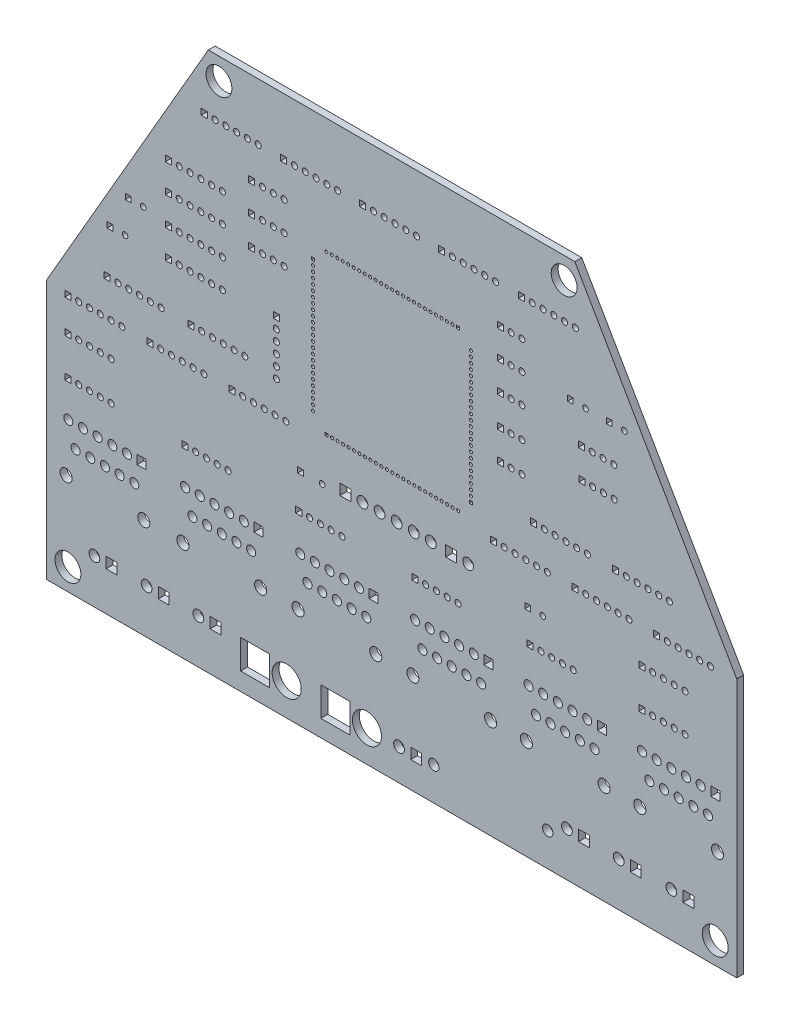
from build123d import *

# Parameters (mm, degrees)
MODEL_R            = 0.65
MODEL_R_2          = 0.7
MODEL_R_3          = 1.2
MODEL_R_4          = 0.35
MODEL_R_5          = 3.375
MODEL_R_6          = 1.05
MODEL_R_7          = 1.4
MODEL_R_8          = 1.25
MODEL_R_9          = 3
MODEL_W            = 1.3
MODEL_H            = 1.3
MODEL_W_2          = 1.4
MODEL_H_2          = 1.4
MODEL_W_3          = 0.7
MODEL_H_3          = 0.7
MODEL_W_4          = 6.75
MODEL_H_4          = 6.75
MODEL_W_5          = 2.1
MODEL_H_5          = 2.1
MODEL_W_6          = 2.5
MODEL_H_6          = 2.5
BOSS_EXTRU_1_DEPTH = 1.6


with BuildPart() as part:
    # Model → Boss.-Extru.1 (new body)
    with BuildSketch(Plane.XY):
        Polygon((0, 0), (160, 0), (160, 60), (122.47, 125), (37.53, 125), (0, 60), align=None)
        with Locations((63.9, 51.1)):
            Circle(MODEL_R, mode=Mode.SUBTRACT)
        with Locations((107.7, 76.2)):
            Circle(MODEL_R_2, mode=Mode.SUBTRACT)
        with Locations((110.2, 76.2)):
            Circle(MODEL_R_2, mode=Mode.SUBTRACT)
        with Locations((107.7, 83.1)):
            Circle(MODEL_R_2, mode=Mode.SUBTRACT)
        with Locations((110.2, 83.1)):
            Circle(MODEL_R_2, mode=Mode.SUBTRACT)
        with Locations((107.7, 90.1)):
            Circle(MODEL_R_2, mode=Mode.SUBTRACT)
        with Locations((110.2, 90.1)):
            Circle(MODEL_R_2, mode=Mode.SUBTRACT)
        with Locations((107.7, 96.8)):
            Circle(MODEL_R_2, mode=Mode.SUBTRACT)
        with Locations((110.2, 96.8)):
            Circle(MODEL_R_2, mode=Mode.SUBTRACT)
        with Locations((107.7, 103.4)):
            Circle(MODEL_R_2, mode=Mode.SUBTRACT)
        with Locations((110.2, 103.4)):
            Circle(MODEL_R_2, mode=Mode.SUBTRACT)
        with Locations((89.8, 7.7)):
            Circle(MODEL_R_3, mode=Mode.SUBTRACT)
        with Locations((116.2, 7.7)):
            Circle(MODEL_R_3, mode=Mode.SUBTRACT)
        with Locations((61.8, 93.89)):
            Circle(MODEL_R_4, mode=Mode.SUBTRACT)
        with Locations((61.8, 92.62)):
            Circle(MODEL_R_4, mode=Mode.SUBTRACT)
        with Locations((61.8, 91.35)):
            Circle(MODEL_R_4, mode=Mode.SUBTRACT)
        with Locations((61.8, 90.08)):
            Circle(MODEL_R_4, mode=Mode.SUBTRACT)
        with Locations((61.8, 88.81)):
            Circle(MODEL_R_4, mode=Mode.SUBTRACT)
        with Locations((61.8, 87.54)):
            Circle(MODEL_R_4, mode=Mode.SUBTRACT)
        with Locations((61.8, 86.27)):
            Circle(MODEL_R_4, mode=Mode.SUBTRACT)
        with Locations((61.8, 85)):
            Circle(MODEL_R_4, mode=Mode.SUBTRACT)
        with Locations((61.8, 83.73)):
            Circle(MODEL_R_4, mode=Mode.SUBTRACT)
        with Locations((61.8, 82.46)):
            Circle(MODEL_R_4, mode=Mode.SUBTRACT)
        with Locations((61.8, 81.19)):
            Circle(MODEL_R_4, mode=Mode.SUBTRACT)
        with Locations((61.8, 79.92)):
            Circle(MODEL_R_4, mode=Mode.SUBTRACT)
        with Locations((61.8, 78.65)):
            Circle(MODEL_R_4, mode=Mode.SUBTRACT)
        with Locations((61.8, 77.38)):
            Circle(MODEL_R_4, mode=Mode.SUBTRACT)
        with Locations((61.8, 76.11)):
            Circle(MODEL_R_4, mode=Mode.SUBTRACT)
        with Locations((61.8, 74.84)):
            Circle(MODEL_R_4, mode=Mode.SUBTRACT)
        with Locations((61.8, 73.57)):
            Circle(MODEL_R_4, mode=Mode.SUBTRACT)
        with Locations((61.8, 72.3)):
            Circle(MODEL_R_4, mode=Mode.SUBTRACT)
        with Locations((61.8, 71.03)):
            Circle(MODEL_R_4, mode=Mode.SUBTRACT)
        with Locations((61.8, 69.76)):
            Circle(MODEL_R_4, mode=Mode.SUBTRACT)
        with Locations((61.8, 68.49)):
            Circle(MODEL_R_4, mode=Mode.SUBTRACT)
        with Locations((61.8, 67.22)):
            Circle(MODEL_R_4, mode=Mode.SUBTRACT)
        with Locations((61.8, 65.95)):
            Circle(MODEL_R_4, mode=Mode.SUBTRACT)
        with Locations((61.8, 64.68)):
            Circle(MODEL_R_4, mode=Mode.SUBTRACT)
        with Locations((66.21, 61.5)):
            Circle(MODEL_R_4, mode=Mode.SUBTRACT)
        with Locations((67.48, 61.5)):
            Circle(MODEL_R_4, mode=Mode.SUBTRACT)
        with Locations((68.75, 61.5)):
            Circle(MODEL_R_4, mode=Mode.SUBTRACT)
        with Locations((70.02, 61.5)):
            Circle(MODEL_R_4, mode=Mode.SUBTRACT)
        with Locations((71.29, 61.5)):
            Circle(MODEL_R_4, mode=Mode.SUBTRACT)
        with Locations((72.56, 61.5)):
            Circle(MODEL_R_4, mode=Mode.SUBTRACT)
        with Locations((73.83, 61.5)):
            Circle(MODEL_R_4, mode=Mode.SUBTRACT)
        with Locations((75.1, 61.5)):
            Circle(MODEL_R_4, mode=Mode.SUBTRACT)
        with Locations((76.37, 61.5)):
            Circle(MODEL_R_4, mode=Mode.SUBTRACT)
        with Locations((77.64, 61.5)):
            Circle(MODEL_R_4, mode=Mode.SUBTRACT)
        with Locations((78.91, 61.5)):
            Circle(MODEL_R_4, mode=Mode.SUBTRACT)
        with Locations((80.18, 61.5)):
            Circle(MODEL_R_4, mode=Mode.SUBTRACT)
        with Locations((81.45, 61.5)):
            Circle(MODEL_R_4, mode=Mode.SUBTRACT)
        with Locations((82.72, 61.5)):
            Circle(MODEL_R_4, mode=Mode.SUBTRACT)
        with Locations((83.99, 61.5)):
            Circle(MODEL_R_4, mode=Mode.SUBTRACT)
        with Locations((85.26, 61.5)):
            Circle(MODEL_R_4, mode=Mode.SUBTRACT)
        with Locations((86.53, 61.5)):
            Circle(MODEL_R_4, mode=Mode.SUBTRACT)
        with Locations((87.8, 61.5)):
            Circle(MODEL_R_4, mode=Mode.SUBTRACT)
        with Locations((89.07, 61.5)):
            Circle(MODEL_R_4, mode=Mode.SUBTRACT)
        with Locations((90.34, 61.5)):
            Circle(MODEL_R_4, mode=Mode.SUBTRACT)
        with Locations((91.61, 61.5)):
            Circle(MODEL_R_4, mode=Mode.SUBTRACT)
        with Locations((92.88, 61.5)):
            Circle(MODEL_R_4, mode=Mode.SUBTRACT)
        with Locations((94.15, 61.5)):
            Circle(MODEL_R_4, mode=Mode.SUBTRACT)
        with Locations((95.42, 61.5)):
            Circle(MODEL_R_4, mode=Mode.SUBTRACT)
        with Locations((94.09, 98.2)):
            Circle(MODEL_R_4, mode=Mode.SUBTRACT)
        with Locations((92.82, 98.2)):
            Circle(MODEL_R_4, mode=Mode.SUBTRACT)
        with Locations((91.55, 98.2)):
            Circle(MODEL_R_4, mode=Mode.SUBTRACT)
        with Locations((90.28, 98.2)):
            Circle(MODEL_R_4, mode=Mode.SUBTRACT)
        with Locations((89.01, 98.2)):
            Circle(MODEL_R_4, mode=Mode.SUBTRACT)
        with Locations((87.74, 98.2)):
            Circle(MODEL_R_4, mode=Mode.SUBTRACT)
        with Locations((86.47, 98.2)):
            Circle(MODEL_R_4, mode=Mode.SUBTRACT)
        with Locations((85.2, 98.2)):
            Circle(MODEL_R_4, mode=Mode.SUBTRACT)
        with Locations((83.93, 98.2)):
            Circle(MODEL_R_4, mode=Mode.SUBTRACT)
        with Locations((82.66, 98.2)):
            Circle(MODEL_R_4, mode=Mode.SUBTRACT)
        with Locations((81.39, 98.2)):
            Circle(MODEL_R_4, mode=Mode.SUBTRACT)
        with Locations((80.12, 98.2)):
            Circle(MODEL_R_4, mode=Mode.SUBTRACT)
        with Locations((78.85, 98.2)):
            Circle(MODEL_R_4, mode=Mode.SUBTRACT)
        with Locations((77.58, 98.2)):
            Circle(MODEL_R_4, mode=Mode.SUBTRACT)
        with Locations((76.31, 98.2)):
            Circle(MODEL_R_4, mode=Mode.SUBTRACT)
        with Locations((75.04, 98.2)):
            Circle(MODEL_R_4, mode=Mode.SUBTRACT)
        with Locations((73.77, 98.2)):
            Circle(MODEL_R_4, mode=Mode.SUBTRACT)
        with Locations((72.5, 98.2)):
            Circle(MODEL_R_4, mode=Mode.SUBTRACT)
        with Locations((71.23, 98.2)):
            Circle(MODEL_R_4, mode=Mode.SUBTRACT)
        with Locations((69.96, 98.2)):
            Circle(MODEL_R_4, mode=Mode.SUBTRACT)
        with Locations((68.69, 98.2)):
            Circle(MODEL_R_4, mode=Mode.SUBTRACT)
        with Locations((67.42, 98.2)):
            Circle(MODEL_R_4, mode=Mode.SUBTRACT)
        with Locations((66.15, 98.2)):
            Circle(MODEL_R_4, mode=Mode.SUBTRACT)
        with Locations((64.88, 98.2)):
            Circle(MODEL_R_4, mode=Mode.SUBTRACT)
        with Locations((98.4, 65.91)):
            Circle(MODEL_R_4, mode=Mode.SUBTRACT)
        with Locations((98.4, 67.18)):
            Circle(MODEL_R_4, mode=Mode.SUBTRACT)
        with Locations((98.4, 68.45)):
            Circle(MODEL_R_4, mode=Mode.SUBTRACT)
        with Locations((98.4, 69.72)):
            Circle(MODEL_R_4, mode=Mode.SUBTRACT)
        with Locations((98.4, 70.99)):
            Circle(MODEL_R_4, mode=Mode.SUBTRACT)
        with Locations((98.4, 72.26)):
            Circle(MODEL_R_4, mode=Mode.SUBTRACT)
        with Locations((98.4, 73.53)):
            Circle(MODEL_R_4, mode=Mode.SUBTRACT)
        with Locations((98.4, 74.8)):
            Circle(MODEL_R_4, mode=Mode.SUBTRACT)
        with Locations((98.4, 76.07)):
            Circle(MODEL_R_4, mode=Mode.SUBTRACT)
        with Locations((98.4, 77.34)):
            Circle(MODEL_R_4, mode=Mode.SUBTRACT)
        with Locations((98.4, 78.61)):
            Circle(MODEL_R_4, mode=Mode.SUBTRACT)
        with Locations((98.4, 79.88)):
            Circle(MODEL_R_4, mode=Mode.SUBTRACT)
        with Locations((98.4, 81.15)):
            Circle(MODEL_R_4, mode=Mode.SUBTRACT)
        with Locations((98.4, 82.42)):
            Circle(MODEL_R_4, mode=Mode.SUBTRACT)
        with Locations((98.4, 83.69)):
            Circle(MODEL_R_4, mode=Mode.SUBTRACT)
        with Locations((98.4, 84.96)):
            Circle(MODEL_R_4, mode=Mode.SUBTRACT)
        with Locations((98.4, 86.23)):
            Circle(MODEL_R_4, mode=Mode.SUBTRACT)
        with Locations((98.4, 87.5)):
            Circle(MODEL_R_4, mode=Mode.SUBTRACT)
        with Locations((98.4, 88.77)):
            Circle(MODEL_R_4, mode=Mode.SUBTRACT)
        with Locations((98.4, 90.04)):
            Circle(MODEL_R_4, mode=Mode.SUBTRACT)
        with Locations((98.4, 91.31)):
            Circle(MODEL_R_4, mode=Mode.SUBTRACT)
        with Locations((98.4, 92.58)):
            Circle(MODEL_R_4, mode=Mode.SUBTRACT)
        with Locations((98.4, 93.85)):
            Circle(MODEL_R_4, mode=Mode.SUBTRACT)
        with Locations((98.4, 95.12)):
            Circle(MODEL_R_4, mode=Mode.SUBTRACT)
        with Locations((55.7, 7.5)):
            Circle(MODEL_R_5, mode=Mode.SUBTRACT)
        with Locations((74.3, 7.3)):
            Circle(MODEL_R_5, mode=Mode.SUBTRACT)
        with Locations((153.33, 29.42)):
            Circle(MODEL_R_6, mode=Mode.SUBTRACT)
        with Locations((151.63, 34.5)):
            Circle(MODEL_R_6, mode=Mode.SUBTRACT)
        with Locations((149.93, 29.42)):
            Circle(MODEL_R_6, mode=Mode.SUBTRACT)
        with Locations((148.23, 34.5)):
            Circle(MODEL_R_6, mode=Mode.SUBTRACT)
        with Locations((146.53, 29.42)):
            Circle(MODEL_R_6, mode=Mode.SUBTRACT)
        with Locations((144.83, 34.5)):
            Circle(MODEL_R_6, mode=Mode.SUBTRACT)
        with Locations((143.13, 29.42)):
            Circle(MODEL_R_6, mode=Mode.SUBTRACT)
        with Locations((141.43, 34.5)):
            Circle(MODEL_R_6, mode=Mode.SUBTRACT)
        with Locations((139.73, 29.42)):
            Circle(MODEL_R_6, mode=Mode.SUBTRACT)
        with Locations((138.03, 34.5)):
            Circle(MODEL_R_6, mode=Mode.SUBTRACT)
        with Locations((155.53, 23.1)):
            Circle(MODEL_R_7, mode=Mode.SUBTRACT)
        with Locations((137.53, 23.1)):
            Circle(MODEL_R_7, mode=Mode.SUBTRACT)
        with Locations((100.75, 29.5)):
            Circle(MODEL_R_6, mode=Mode.SUBTRACT)
        with Locations((99.05, 34.58)):
            Circle(MODEL_R_6, mode=Mode.SUBTRACT)
        with Locations((97.35, 29.5)):
            Circle(MODEL_R_6, mode=Mode.SUBTRACT)
        with Locations((95.65, 34.58)):
            Circle(MODEL_R_6, mode=Mode.SUBTRACT)
        with Locations((93.95, 29.5)):
            Circle(MODEL_R_6, mode=Mode.SUBTRACT)
        with Locations((92.25, 34.58)):
            Circle(MODEL_R_6, mode=Mode.SUBTRACT)
        with Locations((90.55, 29.5)):
            Circle(MODEL_R_6, mode=Mode.SUBTRACT)
        with Locations((88.85, 34.58)):
            Circle(MODEL_R_6, mode=Mode.SUBTRACT)
        with Locations((87.15, 29.5)):
            Circle(MODEL_R_6, mode=Mode.SUBTRACT)
        with Locations((85.45, 34.58)):
            Circle(MODEL_R_6, mode=Mode.SUBTRACT)
        with Locations((102.95, 23.18)):
            Circle(MODEL_R_7, mode=Mode.SUBTRACT)
        with Locations((84.95, 23.18)):
            Circle(MODEL_R_7, mode=Mode.SUBTRACT)
        with Locations((74.14, 29.5)):
            Circle(MODEL_R_6, mode=Mode.SUBTRACT)
        with Locations((72.44, 34.58)):
            Circle(MODEL_R_6, mode=Mode.SUBTRACT)
        with Locations((70.74, 29.5)):
            Circle(MODEL_R_6, mode=Mode.SUBTRACT)
        with Locations((69.04, 34.58)):
            Circle(MODEL_R_6, mode=Mode.SUBTRACT)
        with Locations((67.34, 29.5)):
            Circle(MODEL_R_6, mode=Mode.SUBTRACT)
        with Locations((65.64, 34.58)):
            Circle(MODEL_R_6, mode=Mode.SUBTRACT)
        with Locations((63.94, 29.5)):
            Circle(MODEL_R_6, mode=Mode.SUBTRACT)
        with Locations((62.24, 34.58)):
            Circle(MODEL_R_6, mode=Mode.SUBTRACT)
        with Locations((60.54, 29.5)):
            Circle(MODEL_R_6, mode=Mode.SUBTRACT)
        with Locations((58.84, 34.58)):
            Circle(MODEL_R_6, mode=Mode.SUBTRACT)
        with Locations((76.34, 23.18)):
            Circle(MODEL_R_7, mode=Mode.SUBTRACT)
        with Locations((58.34, 23.18)):
            Circle(MODEL_R_7, mode=Mode.SUBTRACT)
        with Locations((47.46, 29.5)):
            Circle(MODEL_R_6, mode=Mode.SUBTRACT)
        with Locations((45.76, 34.58)):
            Circle(MODEL_R_6, mode=Mode.SUBTRACT)
        with Locations((44.06, 29.5)):
            Circle(MODEL_R_6, mode=Mode.SUBTRACT)
        with Locations((42.36, 34.58)):
            Circle(MODEL_R_6, mode=Mode.SUBTRACT)
        with Locations((40.66, 29.5)):
            Circle(MODEL_R_6, mode=Mode.SUBTRACT)
        with Locations((38.96, 34.58)):
            Circle(MODEL_R_6, mode=Mode.SUBTRACT)
        with Locations((37.26, 29.5)):
            Circle(MODEL_R_6, mode=Mode.SUBTRACT)
        with Locations((35.56, 34.58)):
            Circle(MODEL_R_6, mode=Mode.SUBTRACT)
        with Locations((33.86, 29.5)):
            Circle(MODEL_R_6, mode=Mode.SUBTRACT)
        with Locations((32.16, 34.58)):
            Circle(MODEL_R_6, mode=Mode.SUBTRACT)
        with Locations((49.66, 23.18)):
            Circle(MODEL_R_7, mode=Mode.SUBTRACT)
        with Locations((31.66, 23.18)):
            Circle(MODEL_R_7, mode=Mode.SUBTRACT)
        with Locations((20.39, 29.5)):
            Circle(MODEL_R_6, mode=Mode.SUBTRACT)
        with Locations((18.69, 34.58)):
            Circle(MODEL_R_6, mode=Mode.SUBTRACT)
        with Locations((16.99, 29.5)):
            Circle(MODEL_R_6, mode=Mode.SUBTRACT)
        with Locations((15.29, 34.58)):
            Circle(MODEL_R_6, mode=Mode.SUBTRACT)
        with Locations((13.59, 29.5)):
            Circle(MODEL_R_6, mode=Mode.SUBTRACT)
        with Locations((11.89, 34.58)):
            Circle(MODEL_R_6, mode=Mode.SUBTRACT)
        with Locations((10.19, 29.5)):
            Circle(MODEL_R_6, mode=Mode.SUBTRACT)
        with Locations((8.49, 34.58)):
            Circle(MODEL_R_6, mode=Mode.SUBTRACT)
        with Locations((6.79, 29.5)):
            Circle(MODEL_R_6, mode=Mode.SUBTRACT)
        with Locations((5.09, 34.58)):
            Circle(MODEL_R_6, mode=Mode.SUBTRACT)
        with Locations((22.59, 23.18)):
            Circle(MODEL_R_7, mode=Mode.SUBTRACT)
        with Locations((4.59, 23.18)):
            Circle(MODEL_R_7, mode=Mode.SUBTRACT)
        with Locations((127.04, 29.5)):
            Circle(MODEL_R_6, mode=Mode.SUBTRACT)
        with Locations((125.34, 34.58)):
            Circle(MODEL_R_6, mode=Mode.SUBTRACT)
        with Locations((123.64, 29.5)):
            Circle(MODEL_R_6, mode=Mode.SUBTRACT)
        with Locations((121.94, 34.58)):
            Circle(MODEL_R_6, mode=Mode.SUBTRACT)
        with Locations((120.24, 29.5)):
            Circle(MODEL_R_6, mode=Mode.SUBTRACT)
        with Locations((118.54, 34.58)):
            Circle(MODEL_R_6, mode=Mode.SUBTRACT)
        with Locations((116.84, 29.5)):
            Circle(MODEL_R_6, mode=Mode.SUBTRACT)
        with Locations((115.14, 34.58)):
            Circle(MODEL_R_6, mode=Mode.SUBTRACT)
        with Locations((113.44, 29.5)):
            Circle(MODEL_R_6, mode=Mode.SUBTRACT)
        with Locations((111.74, 34.58)):
            Circle(MODEL_R_6, mode=Mode.SUBTRACT)
        with Locations((129.24, 23.18)):
            Circle(MODEL_R_7, mode=Mode.SUBTRACT)
        with Locations((111.24, 23.18)):
            Circle(MODEL_R_7, mode=Mode.SUBTRACT)
        with Locations((97.76, 52)):
            Circle(MODEL_R_8, mode=Mode.SUBTRACT)
        with Locations((144.84, 10.2)):
            Circle(MODEL_R_8, mode=Mode.SUBTRACT)
        with Locations((132.64, 10.2)):
            Circle(MODEL_R_8, mode=Mode.SUBTRACT)
        with Locations((120.64, 10.3)):
            Circle(MODEL_R_8, mode=Mode.SUBTRACT)
        with Locations((35.24, 10.3)):
            Circle(MODEL_R_8, mode=Mode.SUBTRACT)
        with Locations((23.24, 10.3)):
            Circle(MODEL_R_8, mode=Mode.SUBTRACT)
        with Locations((11.14, 10.3)):
            Circle(MODEL_R_8, mode=Mode.SUBTRACT)
        with Locations((81.74, 7.3)):
            Circle(MODEL_R_8, mode=Mode.SUBTRACT)
        with Locations((120, 120)):
            Circle(MODEL_R_9, mode=Mode.SUBTRACT)
        with Locations((40, 120)):
            Circle(MODEL_R_9, mode=Mode.SUBTRACT)
        with Locations((5, 5)):
            Circle(MODEL_R_9, mode=Mode.SUBTRACT)
        with Locations((155, 5)):
            Circle(MODEL_R_9, mode=Mode.SUBTRACT)
        with Locations((73.26, 52.1)):
            Circle(MODEL_R_8, mode=Mode.SUBTRACT)
        with Locations((77.22, 52.1)):
            Circle(MODEL_R_8, mode=Mode.SUBTRACT)
        with Locations((81.18, 52.1)):
            Circle(MODEL_R_8, mode=Mode.SUBTRACT)
        with Locations((85.14, 52.1)):
            Circle(MODEL_R_8, mode=Mode.SUBTRACT)
        with Locations((89.1, 52.1)):
            Circle(MODEL_R_8, mode=Mode.SUBTRACT)
        with Locations((30.8, 78.5)):
            Circle(MODEL_R_2, mode=Mode.SUBTRACT)
        with Locations((33.3, 78.5)):
            Circle(MODEL_R_2, mode=Mode.SUBTRACT)
        with Locations((35.8, 78.5)):
            Circle(MODEL_R_2, mode=Mode.SUBTRACT)
        with Locations((38.3, 78.5)):
            Circle(MODEL_R_2, mode=Mode.SUBTRACT)
        with Locations((40.8, 78.5)):
            Circle(MODEL_R_2, mode=Mode.SUBTRACT)
        with Locations((30.8, 85.1)):
            Circle(MODEL_R_2, mode=Mode.SUBTRACT)
        with Locations((33.3, 85.1)):
            Circle(MODEL_R_2, mode=Mode.SUBTRACT)
        with Locations((35.8, 85.1)):
            Circle(MODEL_R_2, mode=Mode.SUBTRACT)
        with Locations((38.3, 85.1)):
            Circle(MODEL_R_2, mode=Mode.SUBTRACT)
        with Locations((40.8, 85.1)):
            Circle(MODEL_R_2, mode=Mode.SUBTRACT)
        with Locations((30.8, 91.7)):
            Circle(MODEL_R_2, mode=Mode.SUBTRACT)
        with Locations((33.3, 91.7)):
            Circle(MODEL_R_2, mode=Mode.SUBTRACT)
        with Locations((35.8, 91.7)):
            Circle(MODEL_R_2, mode=Mode.SUBTRACT)
        with Locations((38.3, 91.7)):
            Circle(MODEL_R_2, mode=Mode.SUBTRACT)
        with Locations((40.8, 91.7)):
            Circle(MODEL_R_2, mode=Mode.SUBTRACT)
        with Locations((30.8, 98.3)):
            Circle(MODEL_R_2, mode=Mode.SUBTRACT)
        with Locations((33.3, 98.3)):
            Circle(MODEL_R_2, mode=Mode.SUBTRACT)
        with Locations((35.8, 98.3)):
            Circle(MODEL_R_2, mode=Mode.SUBTRACT)
        with Locations((38.3, 98.3)):
            Circle(MODEL_R_2, mode=Mode.SUBTRACT)
        with Locations((40.8, 98.3)):
            Circle(MODEL_R_2, mode=Mode.SUBTRACT)
        with Locations((26.5, 59.5)):
            Circle(MODEL_R_2, mode=Mode.SUBTRACT)
        with Locations((29, 59.5)):
            Circle(MODEL_R_2, mode=Mode.SUBTRACT)
        with Locations((31.5, 59.5)):
            Circle(MODEL_R_2, mode=Mode.SUBTRACT)
        with Locations((34, 59.5)):
            Circle(MODEL_R_2, mode=Mode.SUBTRACT)
        with Locations((36.5, 59.5)):
            Circle(MODEL_R_2, mode=Mode.SUBTRACT)
        with Locations((94.1, 111.8)):
            Circle(MODEL_R_2, mode=Mode.SUBTRACT)
        with Locations((96.6, 111.8)):
            Circle(MODEL_R_2, mode=Mode.SUBTRACT)
        with Locations((99.1, 111.8)):
            Circle(MODEL_R_2, mode=Mode.SUBTRACT)
        with Locations((101.6, 111.8)):
            Circle(MODEL_R_2, mode=Mode.SUBTRACT)
        with Locations((104.1, 111.8)):
            Circle(MODEL_R_2, mode=Mode.SUBTRACT)
        with Locations((75.8, 111.8)):
            Circle(MODEL_R_2, mode=Mode.SUBTRACT)
        with Locations((78.3, 111.8)):
            Circle(MODEL_R_2, mode=Mode.SUBTRACT)
        with Locations((80.8, 111.8)):
            Circle(MODEL_R_2, mode=Mode.SUBTRACT)
        with Locations((83.3, 111.8)):
            Circle(MODEL_R_2, mode=Mode.SUBTRACT)
        with Locations((85.8, 111.8)):
            Circle(MODEL_R_2, mode=Mode.SUBTRACT)
        with Locations((57.5, 111.8)):
            Circle(MODEL_R_2, mode=Mode.SUBTRACT)
        with Locations((60, 111.8)):
            Circle(MODEL_R_2, mode=Mode.SUBTRACT)
        with Locations((62.5, 111.8)):
            Circle(MODEL_R_2, mode=Mode.SUBTRACT)
        with Locations((65, 111.8)):
            Circle(MODEL_R_2, mode=Mode.SUBTRACT)
        with Locations((67.5, 111.8)):
            Circle(MODEL_R_2, mode=Mode.SUBTRACT)
        with Locations((39.1, 111.8)):
            Circle(MODEL_R_2, mode=Mode.SUBTRACT)
        with Locations((41.6, 111.8)):
            Circle(MODEL_R_2, mode=Mode.SUBTRACT)
        with Locations((44.1, 111.8)):
            Circle(MODEL_R_2, mode=Mode.SUBTRACT)
        with Locations((46.6, 111.8)):
            Circle(MODEL_R_2, mode=Mode.SUBTRACT)
        with Locations((49.1, 111.8)):
            Circle(MODEL_R_2, mode=Mode.SUBTRACT)
        with Locations((16.6, 67.8)):
            Circle(MODEL_R_2, mode=Mode.SUBTRACT)
        with Locations((19.1, 67.8)):
            Circle(MODEL_R_2, mode=Mode.SUBTRACT)
        with Locations((21.6, 67.8)):
            Circle(MODEL_R_2, mode=Mode.SUBTRACT)
        with Locations((24.1, 67.8)):
            Circle(MODEL_R_2, mode=Mode.SUBTRACT)
        with Locations((26.6, 67.8)):
            Circle(MODEL_R_2, mode=Mode.SUBTRACT)
        with Locations((45.5, 59.5)):
            Circle(MODEL_R_2, mode=Mode.SUBTRACT)
        with Locations((48, 59.5)):
            Circle(MODEL_R_2, mode=Mode.SUBTRACT)
        with Locations((50.5, 59.5)):
            Circle(MODEL_R_2, mode=Mode.SUBTRACT)
        with Locations((53, 59.5)):
            Circle(MODEL_R_2, mode=Mode.SUBTRACT)
        with Locations((55.5, 59.5)):
            Circle(MODEL_R_2, mode=Mode.SUBTRACT)
        with Locations((7.5, 59.5)):
            Circle(MODEL_R_2, mode=Mode.SUBTRACT)
        with Locations((10, 59.5)):
            Circle(MODEL_R_2, mode=Mode.SUBTRACT)
        with Locations((12.5, 59.5)):
            Circle(MODEL_R_2, mode=Mode.SUBTRACT)
        with Locations((15, 59.5)):
            Circle(MODEL_R_2, mode=Mode.SUBTRACT)
        with Locations((17.5, 59.5)):
            Circle(MODEL_R_2, mode=Mode.SUBTRACT)
        with Locations((115.4, 67.8)):
            Circle(MODEL_R_2, mode=Mode.SUBTRACT)
        with Locations((117.9, 67.8)):
            Circle(MODEL_R_2, mode=Mode.SUBTRACT)
        with Locations((120.4, 67.8)):
            Circle(MODEL_R_2, mode=Mode.SUBTRACT)
        with Locations((122.9, 67.8)):
            Circle(MODEL_R_2, mode=Mode.SUBTRACT)
        with Locations((125.4, 67.8)):
            Circle(MODEL_R_2, mode=Mode.SUBTRACT)
        with Locations((134.4, 67.8)):
            Circle(MODEL_R_2, mode=Mode.SUBTRACT)
        with Locations((136.9, 67.8)):
            Circle(MODEL_R_2, mode=Mode.SUBTRACT)
        with Locations((139.4, 67.8)):
            Circle(MODEL_R_2, mode=Mode.SUBTRACT)
        with Locations((141.9, 67.8)):
            Circle(MODEL_R_2, mode=Mode.SUBTRACT)
        with Locations((144.4, 67.8)):
            Circle(MODEL_R_2, mode=Mode.SUBTRACT)
        with Locations((106.1, 59.5)):
            Circle(MODEL_R_2, mode=Mode.SUBTRACT)
        with Locations((108.6, 59.5)):
            Circle(MODEL_R_2, mode=Mode.SUBTRACT)
        with Locations((111.1, 59.5)):
            Circle(MODEL_R_2, mode=Mode.SUBTRACT)
        with Locations((113.6, 59.5)):
            Circle(MODEL_R_2, mode=Mode.SUBTRACT)
        with Locations((116.1, 59.5)):
            Circle(MODEL_R_2, mode=Mode.SUBTRACT)
        with Locations((125, 59.5)):
            Circle(MODEL_R_2, mode=Mode.SUBTRACT)
        with Locations((127.5, 59.5)):
            Circle(MODEL_R_2, mode=Mode.SUBTRACT)
        with Locations((130, 59.5)):
            Circle(MODEL_R_2, mode=Mode.SUBTRACT)
        with Locations((132.5, 59.5)):
            Circle(MODEL_R_2, mode=Mode.SUBTRACT)
        with Locations((135, 59.5)):
            Circle(MODEL_R_2, mode=Mode.SUBTRACT)
        with Locations((143.9, 59.5)):
            Circle(MODEL_R_2, mode=Mode.SUBTRACT)
        with Locations((146.4, 59.5)):
            Circle(MODEL_R_2, mode=Mode.SUBTRACT)
        with Locations((148.9, 59.5)):
            Circle(MODEL_R_2, mode=Mode.SUBTRACT)
        with Locations((151.4, 59.5)):
            Circle(MODEL_R_2, mode=Mode.SUBTRACT)
        with Locations((153.9, 59.5)):
            Circle(MODEL_R_2, mode=Mode.SUBTRACT)
        with Locations((36, 67.8)):
            Circle(MODEL_R_2, mode=Mode.SUBTRACT)
        with Locations((38.5, 67.8)):
            Circle(MODEL_R_2, mode=Mode.SUBTRACT)
        with Locations((41, 67.8)):
            Circle(MODEL_R_2, mode=Mode.SUBTRACT)
        with Locations((43.5, 67.8)):
            Circle(MODEL_R_2, mode=Mode.SUBTRACT)
        with Locations((46, 67.8)):
            Circle(MODEL_R_2, mode=Mode.SUBTRACT)
        with Locations((112.6, 111.8)):
            Circle(MODEL_R_2, mode=Mode.SUBTRACT)
        with Locations((115.1, 111.8)):
            Circle(MODEL_R_2, mode=Mode.SUBTRACT)
        with Locations((117.6, 111.8)):
            Circle(MODEL_R_2, mode=Mode.SUBTRACT)
        with Locations((120.1, 111.8)):
            Circle(MODEL_R_2, mode=Mode.SUBTRACT)
        with Locations((122.6, 111.8)):
            Circle(MODEL_R_2, mode=Mode.SUBTRACT)
        with Locations((53.3, 76.9)):
            Circle(MODEL_R_2, mode=Mode.SUBTRACT)
        with Locations((53.3, 74.4)):
            Circle(MODEL_R_2, mode=Mode.SUBTRACT)
        with Locations((53.3, 71.9)):
            Circle(MODEL_R_2, mode=Mode.SUBTRACT)
        with Locations((53.3, 69.4)):
            Circle(MODEL_R_2, mode=Mode.SUBTRACT)
        with Locations((53.3, 66.9)):
            Circle(MODEL_R_2, mode=Mode.SUBTRACT)
        with Locations((140.5, 51.6)):
            Circle(MODEL_R_2, mode=Mode.SUBTRACT)
        with Locations((143, 51.6)):
            Circle(MODEL_R_2, mode=Mode.SUBTRACT)
        with Locations((145.5, 51.6)):
            Circle(MODEL_R_2, mode=Mode.SUBTRACT)
        with Locations((148, 51.6)):
            Circle(MODEL_R_2, mode=Mode.SUBTRACT)
        with Locations((7.5, 51.8)):
            Circle(MODEL_R_2, mode=Mode.SUBTRACT)
        with Locations((10, 51.8)):
            Circle(MODEL_R_2, mode=Mode.SUBTRACT)
        with Locations((12.5, 51.8)):
            Circle(MODEL_R_2, mode=Mode.SUBTRACT)
        with Locations((15, 51.8)):
            Circle(MODEL_R_2, mode=Mode.SUBTRACT)
        with Locations((140.5, 42.9)):
            Circle(MODEL_R_2, mode=Mode.SUBTRACT)
        with Locations((143, 42.9)):
            Circle(MODEL_R_2, mode=Mode.SUBTRACT)
        with Locations((145.5, 42.9)):
            Circle(MODEL_R_2, mode=Mode.SUBTRACT)
        with Locations((148, 42.9)):
            Circle(MODEL_R_2, mode=Mode.SUBTRACT)
        with Locations((114.6, 42.9)):
            Circle(MODEL_R_2, mode=Mode.SUBTRACT)
        with Locations((117.1, 42.9)):
            Circle(MODEL_R_2, mode=Mode.SUBTRACT)
        with Locations((119.6, 42.9)):
            Circle(MODEL_R_2, mode=Mode.SUBTRACT)
        with Locations((122.1, 42.9)):
            Circle(MODEL_R_2, mode=Mode.SUBTRACT)
        with Locations((87.9, 42.9)):
            Circle(MODEL_R_2, mode=Mode.SUBTRACT)
        with Locations((90.4, 42.9)):
            Circle(MODEL_R_2, mode=Mode.SUBTRACT)
        with Locations((92.9, 42.9)):
            Circle(MODEL_R_2, mode=Mode.SUBTRACT)
        with Locations((95.4, 42.9)):
            Circle(MODEL_R_2, mode=Mode.SUBTRACT)
        with Locations((61, 42.9)):
            Circle(MODEL_R_2, mode=Mode.SUBTRACT)
        with Locations((63.5, 42.9)):
            Circle(MODEL_R_2, mode=Mode.SUBTRACT)
        with Locations((66, 42.9)):
            Circle(MODEL_R_2, mode=Mode.SUBTRACT)
        with Locations((68.5, 42.9)):
            Circle(MODEL_R_2, mode=Mode.SUBTRACT)
        with Locations((7.5, 42.85)):
            Circle(MODEL_R_2, mode=Mode.SUBTRACT)
        with Locations((10, 42.85)):
            Circle(MODEL_R_2, mode=Mode.SUBTRACT)
        with Locations((12.5, 42.85)):
            Circle(MODEL_R_2, mode=Mode.SUBTRACT)
        with Locations((15, 42.85)):
            Circle(MODEL_R_2, mode=Mode.SUBTRACT)
        with Locations((34.6, 42.9)):
            Circle(MODEL_R_2, mode=Mode.SUBTRACT)
        with Locations((37.1, 42.9)):
            Circle(MODEL_R_2, mode=Mode.SUBTRACT)
        with Locations((39.6, 42.9)):
            Circle(MODEL_R_2, mode=Mode.SUBTRACT)
        with Locations((42.1, 42.9)):
            Circle(MODEL_R_2, mode=Mode.SUBTRACT)
        with Locations((126.6, 81.9)):
            Circle(MODEL_R_2, mode=Mode.SUBTRACT)
        with Locations((129.1, 81.9)):
            Circle(MODEL_R_2, mode=Mode.SUBTRACT)
        with Locations((131.6, 81.9)):
            Circle(MODEL_R_2, mode=Mode.SUBTRACT)
        with Locations((126.5, 88.8)):
            Circle(MODEL_R_2, mode=Mode.SUBTRACT)
        with Locations((129, 88.8)):
            Circle(MODEL_R_2, mode=Mode.SUBTRACT)
        with Locations((131.5, 88.8)):
            Circle(MODEL_R_2, mode=Mode.SUBTRACT)
        with Locations((50.1, 90.4)):
            Circle(MODEL_R_2, mode=Mode.SUBTRACT)
        with Locations((52.6, 90.4)):
            Circle(MODEL_R_2, mode=Mode.SUBTRACT)
        with Locations((55.1, 90.4)):
            Circle(MODEL_R_2, mode=Mode.SUBTRACT)
        with Locations((50.1, 97.1)):
            Circle(MODEL_R_2, mode=Mode.SUBTRACT)
        with Locations((52.6, 97.1)):
            Circle(MODEL_R_2, mode=Mode.SUBTRACT)
        with Locations((55.1, 97.1)):
            Circle(MODEL_R_2, mode=Mode.SUBTRACT)
        with Locations((50.1, 103.8)):
            Circle(MODEL_R_2, mode=Mode.SUBTRACT)
        with Locations((52.6, 103.8)):
            Circle(MODEL_R_2, mode=Mode.SUBTRACT)
        with Locations((55.1, 103.8)):
            Circle(MODEL_R_2, mode=Mode.SUBTRACT)
        with Locations((115.05, 50.2)):
            Circle(MODEL_R, mode=Mode.SUBTRACT)
        with Locations((124.95, 96.8)):
            Circle(MODEL_R, mode=Mode.SUBTRACT)
        with Locations((133.95, 96.8)):
            Circle(MODEL_R, mode=Mode.SUBTRACT)
        with Locations((22.45, 86)):
            Circle(MODEL_R, mode=Mode.SUBTRACT)
        with Locations((18.25, 78.2)):
            Circle(MODEL_R, mode=Mode.SUBTRACT)
        with Locations((58.9, 51.1)):
            Rectangle(MODEL_W, MODEL_H, mode=Mode.SUBTRACT)
        with Locations((105.2, 76.2)):
            Rectangle(MODEL_W_2, MODEL_H_2, mode=Mode.SUBTRACT)
        with Locations((105.2, 83.1)):
            Rectangle(MODEL_W_2, MODEL_H_2, mode=Mode.SUBTRACT)
        with Locations((105.2, 90.1)):
            Rectangle(MODEL_W_2, MODEL_H_2, mode=Mode.SUBTRACT)
        with Locations((105.2, 96.8)):
            Rectangle(MODEL_W_2, MODEL_H_2, mode=Mode.SUBTRACT)
        with Locations((105.2, 103.4)):
            Rectangle(MODEL_W_2, MODEL_H_2, mode=Mode.SUBTRACT)
        with Locations((61.8, 95.16)):
            Rectangle(MODEL_W_3, MODEL_H_3, mode=Mode.SUBTRACT)
        with Locations((64.94, 61.5)):
            Rectangle(MODEL_W_3, MODEL_H_3, mode=Mode.SUBTRACT)
        with Locations((95.36, 98.2)):
            Rectangle(MODEL_W_3, MODEL_H_3, mode=Mode.SUBTRACT)
        with Locations((98.4, 64.64)):
            Rectangle(MODEL_W_3, MODEL_H_3, mode=Mode.SUBTRACT)
        with Locations((48.4, 7.5)):
            Rectangle(MODEL_W_4, MODEL_H_4, mode=Mode.SUBTRACT)
        with Locations((67, 7.3)):
            Rectangle(MODEL_W_4, MODEL_H_4, mode=Mode.SUBTRACT)
        with Locations((155.03, 34.5)):
            Rectangle(MODEL_W_5, MODEL_H_5, mode=Mode.SUBTRACT)
        with Locations((102.45, 34.58)):
            Rectangle(MODEL_W_5, MODEL_H_5, mode=Mode.SUBTRACT)
        with Locations((75.84, 34.58)):
            Rectangle(MODEL_W_5, MODEL_H_5, mode=Mode.SUBTRACT)
        with Locations((49.16, 34.58)):
            Rectangle(MODEL_W_5, MODEL_H_5, mode=Mode.SUBTRACT)
        with Locations((22.09, 34.58)):
            Rectangle(MODEL_W_5, MODEL_H_5, mode=Mode.SUBTRACT)
        with Locations((128.74, 34.58)):
            Rectangle(MODEL_W_5, MODEL_H_5, mode=Mode.SUBTRACT)
        with Locations((93.8, 52)):
            Rectangle(MODEL_W_6, MODEL_H_6, mode=Mode.SUBTRACT)
        with Locations((148.8, 10.2)):
            Rectangle(MODEL_W_6, MODEL_H_6, mode=Mode.SUBTRACT)
        with Locations((136.6, 10.2)):
            Rectangle(MODEL_W_6, MODEL_H_6, mode=Mode.SUBTRACT)
        with Locations((124.6, 10.3)):
            Rectangle(MODEL_W_6, MODEL_H_6, mode=Mode.SUBTRACT)
        with Locations((39.2, 10.3)):
            Rectangle(MODEL_W_6, MODEL_H_6, mode=Mode.SUBTRACT)
        with Locations((27.2, 10.3)):
            Rectangle(MODEL_W_6, MODEL_H_6, mode=Mode.SUBTRACT)
        with Locations((15.1, 10.3)):
            Rectangle(MODEL_W_6, MODEL_H_6, mode=Mode.SUBTRACT)
        with Locations((85.7, 7.3)):
            Rectangle(MODEL_W_6, MODEL_H_6, mode=Mode.SUBTRACT)
        with Locations((69.3, 52.1)):
            Rectangle(MODEL_W_6, MODEL_H_6, mode=Mode.SUBTRACT)
        with Locations((28.3, 78.5)):
            Rectangle(MODEL_W_2, MODEL_H_2, mode=Mode.SUBTRACT)
        with Locations((28.3, 85.1)):
            Rectangle(MODEL_W_2, MODEL_H_2, mode=Mode.SUBTRACT)
        with Locations((28.3, 91.7)):
            Rectangle(MODEL_W_2, MODEL_H_2, mode=Mode.SUBTRACT)
        with Locations((28.3, 98.3)):
            Rectangle(MODEL_W_2, MODEL_H_2, mode=Mode.SUBTRACT)
        with Locations((24, 59.5)):
            Rectangle(MODEL_W_2, MODEL_H_2, mode=Mode.SUBTRACT)
        with Locations((91.6, 111.8)):
            Rectangle(MODEL_W_2, MODEL_H_2, mode=Mode.SUBTRACT)
        with Locations((73.3, 111.8)):
            Rectangle(MODEL_W_2, MODEL_H_2, mode=Mode.SUBTRACT)
        with Locations((55, 111.8)):
            Rectangle(MODEL_W_2, MODEL_H_2, mode=Mode.SUBTRACT)
        with Locations((36.6, 111.8)):
            Rectangle(MODEL_W_2, MODEL_H_2, mode=Mode.SUBTRACT)
        with Locations((14.1, 67.8)):
            Rectangle(MODEL_W_2, MODEL_H_2, mode=Mode.SUBTRACT)
        with Locations((43, 59.5)):
            Rectangle(MODEL_W_2, MODEL_H_2, mode=Mode.SUBTRACT)
        with Locations((5, 59.5)):
            Rectangle(MODEL_W_2, MODEL_H_2, mode=Mode.SUBTRACT)
        with Locations((112.9, 67.8)):
            Rectangle(MODEL_W_2, MODEL_H_2, mode=Mode.SUBTRACT)
        with Locations((131.9, 67.8)):
            Rectangle(MODEL_W_2, MODEL_H_2, mode=Mode.SUBTRACT)
        with Locations((103.6, 59.5)):
            Rectangle(MODEL_W_2, MODEL_H_2, mode=Mode.SUBTRACT)
        with Locations((122.5, 59.5)):
            Rectangle(MODEL_W_2, MODEL_H_2, mode=Mode.SUBTRACT)
        with Locations((141.4, 59.5)):
            Rectangle(MODEL_W_2, MODEL_H_2, mode=Mode.SUBTRACT)
        with Locations((33.5, 67.8)):
            Rectangle(MODEL_W_2, MODEL_H_2, mode=Mode.SUBTRACT)
        with Locations((110.1, 111.8)):
            Rectangle(MODEL_W_2, MODEL_H_2, mode=Mode.SUBTRACT)
        with Locations((53.3, 79.4)):
            Rectangle(MODEL_W_2, MODEL_H_2, mode=Mode.SUBTRACT)
        with Locations((138, 51.6)):
            Rectangle(MODEL_W_2, MODEL_H_2, mode=Mode.SUBTRACT)
        with Locations((5, 51.8)):
            Rectangle(MODEL_W_2, MODEL_H_2, mode=Mode.SUBTRACT)
        with Locations((138, 42.9)):
            Rectangle(MODEL_W_2, MODEL_H_2, mode=Mode.SUBTRACT)
        with Locations((112.1, 42.9)):
            Rectangle(MODEL_W_2, MODEL_H_2, mode=Mode.SUBTRACT)
        with Locations((85.4, 42.9)):
            Rectangle(MODEL_W_2, MODEL_H_2, mode=Mode.SUBTRACT)
        with Locations((58.5, 42.9)):
            Rectangle(MODEL_W_2, MODEL_H_2, mode=Mode.SUBTRACT)
        with Locations((5, 42.85)):
            Rectangle(MODEL_W_2, MODEL_H_2, mode=Mode.SUBTRACT)
        with Locations((32.1, 42.9)):
            Rectangle(MODEL_W_2, MODEL_H_2, mode=Mode.SUBTRACT)
        with Locations((124.1, 81.9)):
            Rectangle(MODEL_W_2, MODEL_H_2, mode=Mode.SUBTRACT)
        with Locations((124, 88.8)):
            Rectangle(MODEL_W_2, MODEL_H_2, mode=Mode.SUBTRACT)
        with Locations((47.6, 90.4)):
            Rectangle(MODEL_W_2, MODEL_H_2, mode=Mode.SUBTRACT)
        with Locations((47.6, 97.1)):
            Rectangle(MODEL_W_2, MODEL_H_2, mode=Mode.SUBTRACT)
        with Locations((47.6, 103.8)):
            Rectangle(MODEL_W_2, MODEL_H_2, mode=Mode.SUBTRACT)
        with Locations((111.55, 50.2)):
            Rectangle(MODEL_W, MODEL_H, mode=Mode.SUBTRACT)
        with Locations((121.45, 96.8)):
            Rectangle(MODEL_W, MODEL_H, mode=Mode.SUBTRACT)
        with Locations((130.45, 96.8)):
            Rectangle(MODEL_W, MODEL_H, mode=Mode.SUBTRACT)
        with Locations((18.95, 86)):
            Rectangle(MODEL_W, MODEL_H, mode=Mode.SUBTRACT)
        with Locations((14.75, 78.2)):
            Rectangle(MODEL_W, MODEL_H, mode=Mode.SUBTRACT)
    extrude(amount=BOSS_EXTRU_1_DEPTH)


solid = part.part
